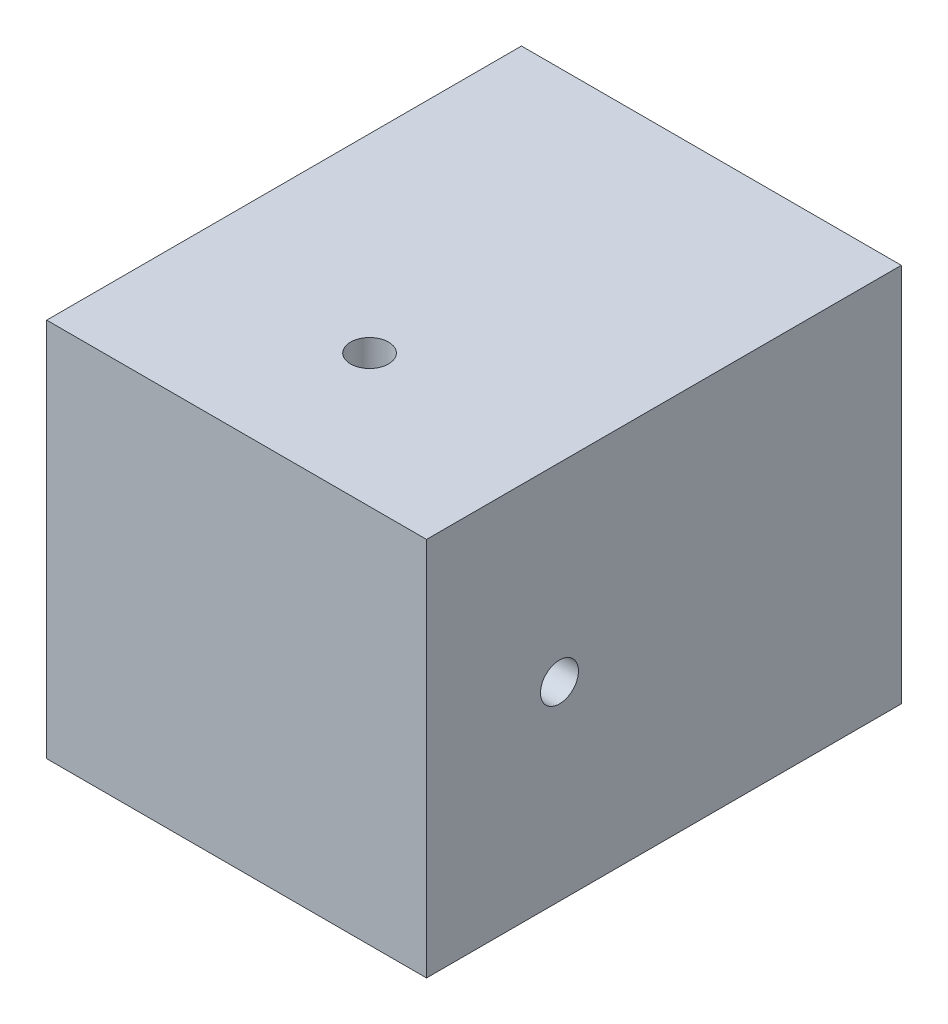
from build123d import *

# Parameters (mm, degrees)
SKETCH1_W           = 20
SKETCH1_H           = 20
BOSS_EXTRUDE1_DEPTH = 25
SKETCH2_R           = 1
CUT_EXTRUDE1_DEPTH  = 25
SKETCH3_R           = 1
CUT_EXTRUDE2_DEPTH  = 25


with BuildPart() as part:
    # Sketch1 → Boss-Extrude1 (new body)
    with BuildSketch(Plane.XY):
        Rectangle(SKETCH1_W, SKETCH1_H)
    extrude(amount=BOSS_EXTRUDE1_DEPTH)

    # Sketch2 → Cut-Extrude1 (cut)
    with BuildSketch(Plane(origin=(10, 0, 0), x_dir=(0, 0, -1), z_dir=(1, 0, 0))):
        with Locations((-18, 0)):
            Circle(SKETCH2_R)
    extrude(amount=-CUT_EXTRUDE1_DEPTH, mode=Mode.SUBTRACT)

    # Sketch3 → Cut-Extrude2 (cut)
    with BuildSketch(Plane(origin=(0, 10, 0), x_dir=(1, 0, 0), z_dir=(0, 1, 0))):
        with Locations((0, -18)):
            Circle(SKETCH3_R)
    extrude(amount=-CUT_EXTRUDE2_DEPTH, mode=Mode.SUBTRACT)


solid = part.part
